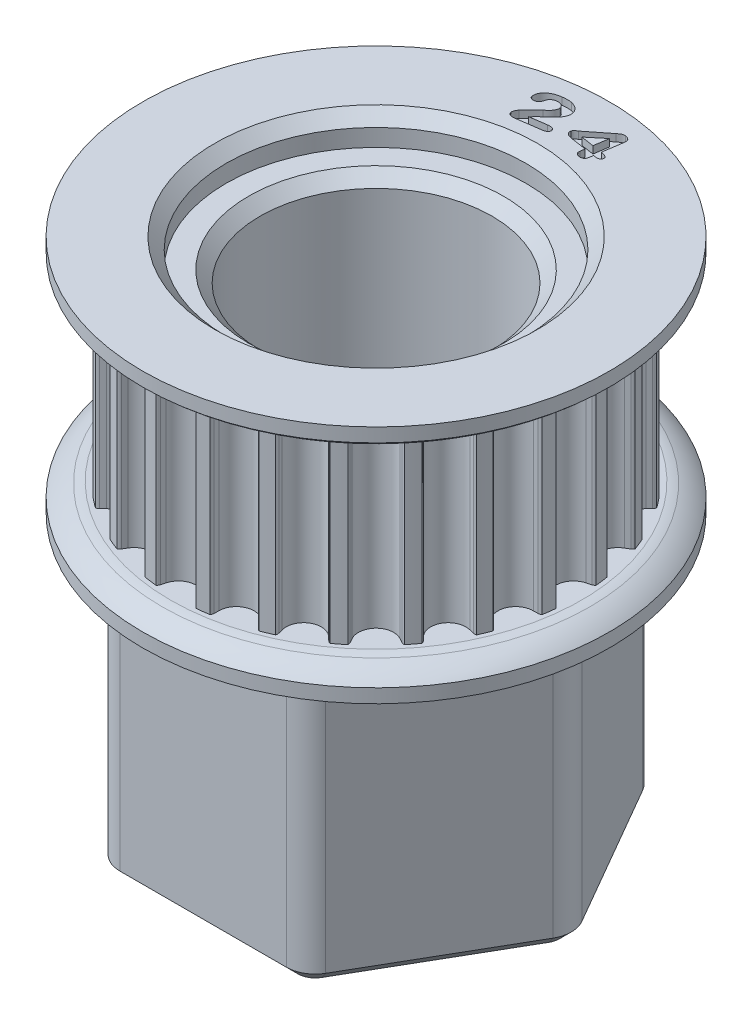
from build123d import *

# Parameters (mm, degrees)
SKETCH1_R                    = 11.078156269
TOOTHOD_DEPTH                = 5.08
TOOTHPROFILE_DEPTH           = 17.469896559
TOOTHPATTERN_COUNT           = 24
BORE_DEPTH                   = 20.343586122
BORE_DEPTH_BACK              = 20.343586122
SKETCH7_R                    = 6.3881
SMALL_TOOTH_COUNT_DEPTH      = 23.472489227
SMALL_TOOTH_COUNT_DEPTH_BACK = 0.4
SKETCH12_R                   = 6.3881
BOSS_EXTRUDE1_DEPTH          = 15.24
SKETCH27_R                   = 8.255
CUT_EXTRUDE1_DEPTH           = 1.5875
FILLET1_R                    = 1.5875
CUT_SWEEP1_PROFILE_R         = 0.3175
FILLET2_R                    = 1.27
CHAMFER1_SIZE                = 0.635
CHAMFER2_SIZE                = 0.635


with BuildPart() as part:
    # Sketch1 → ToothOD (new, symmetric)
    with BuildSketch(Plane(origin=(0, 0, 0), x_dir=(1, 0, 0), z_dir=(0, 1, 0))):
        Circle(SKETCH1_R)
    extrude(amount=TOOTHOD_DEPTH, both=True)

    # Sketch2 → ToothProfile (cut, symmetric)
    with BuildSketch(Plane(origin=(0, 0, 0), x_dir=(1, 0, 0), z_dir=(0, 1, 0))):
        with BuildLine():
            ThreePointArc((-0.937033068, 10.628218265), (-0.590385173, 10.110043655), (0, 9.909756269))
            ThreePointArc((0, 9.909756269), (0.590385173, 10.110043655), (0.937033068, 10.628218265))
            ThreePointArc((0.937033068, 10.628218265), (0.971699064, 10.754329727), (1.007805813, 10.880036269))
            ThreePointArc((1.007805813, 10.880036269), (1.043742495, 10.958436311), (1.100516181, 11.023357495))
            ThreePointArc((1.100516181, 11.023357495), (0, 11.078156269), (-1.100516181, 11.023357495))
            ThreePointArc((-1.100516181, 11.023357495), (-1.043742495, 10.958436311), (-1.007805813, 10.880036269))
            ThreePointArc((-1.007805813, 10.880036269), (-0.971699064, 10.754329727), (-0.937033068, 10.628218265))
        make_face()
    toothprofile = extrude(amount=TOOTHPROFILE_DEPTH, both=True, mode=Mode.SUBTRACT)

    # ToothPattern: ToothProfile ×24 about axis
    toothpattern_axis = Axis((0, 5.08, 0), (0, -1, 0))
    for i in range(1, TOOTHPATTERN_COUNT):
        add(toothprofile.rotate(toothpattern_axis, i * 360 / TOOTHPATTERN_COUNT), mode=Mode.SUBTRACT)

    # Sketch4 → Flange (revolve)
    with BuildSketch(Plane.XY):
        with BuildLine():
            Line((0, -5.08), (11.332156269, -5.08))
            ThreePointArc((11.332156269, -5.08), (11.56180289, -5.115951298), (11.787228598, -5.172637424))
            ThreePointArc((11.787228598, -5.172637424), (12.354957174, -5.454197125), (12.856156269, -5.842))
            Line((12.856156269, -5.842), (12.856156269, -6.604))
            Line((12.856156269, -6.604), (0, -6.604))
            Line((0, -6.604), (0, -5.08))
        make_face()
        with BuildLine():
            Line((12.856156269, 6.604), (12.856156269, 5.842))
            ThreePointArc((12.856156269, 5.842), (12.354957174, 5.454197125), (11.787228598, 5.172637424))
            ThreePointArc((11.787228598, 5.172637424), (11.56180289, 5.115951298), (11.332156269, 5.08))
            Line((11.332156269, 5.08), (0, 5.08))
            Line((0, 5.08), (0, 6.604))
            Line((0, 6.604), (12.856156269, 6.604))
        make_face()
    revolve(axis=Axis((0, 8.0264, 0), (0, -1, 0)))

    # Sketch7 → Bore (cut, two sides: drawn at the far end of the back side and taken through both)
    with BuildSketch(Plane.XZ.offset(-BORE_DEPTH_BACK)):
        Circle(SKETCH7_R)
    extrude(amount=BORE_DEPTH + BORE_DEPTH_BACK, mode=Mode.SUBTRACT)

    # Sketch11 → Small Tooth Count (cut, two sides: drawn at the far end of the back side and taken through both)
    # profile 1 of 2: a face of its own
    with BuildSketch(Plane(origin=(0, 6.604, 0), x_dir=(1, 0, 0), z_dir=(0, 1, 0)).offset(-SMALL_TOOTH_COUNT_DEPTH_BACK)):
        with BuildLine():
            Line((-1.50932721, 9.916837863), (-0.597606116, 10.046764816))
            add(Edge.make_bspline(
                [(-0.597606116, 10.046764816), (-0.571157489, 10.050105826), (-0.52120142, 10.056416311), (-0.449541333, 10.055313599), (-0.385667722, 10.047305308), (-0.330562884, 10.029277348), (-0.28444503, 10.005378402), (-0.249016623, 9.974662726), (-0.224075796, 9.938023746), (-0.217996356, 9.910169852), (-0.214969007, 9.896299582)],
                knots=[0, 0, 0, 0, 1.407436454, 2.658360686, 3.778686155, 4.796186387, 5.707822169, 6.504860125, 7.25547238, 8, 8, 8, 8], degree=3))
            add(Edge.make_bspline(
                [(-0.214969007, 9.896299582), (-0.213936308, 9.883603258), (-0.211851942, 9.857977408), (-0.222454605, 9.819456736), (-0.242047158, 9.78205115), (-0.270462476, 9.745517337), (-0.309742938, 9.712270871), (-0.360197484, 9.685833025), (-0.421026872, 9.665765439), (-0.465453114, 9.658287244), (-0.489110413, 9.654305051)],
                knots=[0, 0, 0, 0, 0.748192561, 1.510127746, 2.320859081, 3.236210595, 4.228876646, 5.33922549, 6.583118088, 8, 8, 8, 8], degree=3))
            Line((-0.489110413, 9.654305051), (-1.858031507, 9.458744894))
            add(Edge.make_bspline(
                [(-1.858031507, 9.458744894), (-1.881812164, 9.456078685), (-1.927114595, 9.450999526), (-1.992824891, 9.455151256), (-2.052190696, 9.468165459), (-2.104274077, 9.490978722), (-2.147742871, 9.521062832), (-2.181559921, 9.557126937), (-2.205078512, 9.598853341), (-2.211523929, 9.629488347), (-2.214772522, 9.644928879)],
                knots=[0, 0, 0, 0, 1.281292524, 2.440877223, 3.513557772, 4.524978182, 5.470507004, 6.329058183, 7.157818661, 8, 8, 8, 8], degree=3))
            add(Edge.make_bspline(
                [(-2.214772522, 9.644928879), (-2.215569805, 9.655797352), (-2.217301044, 9.679397428), (-2.212074679, 9.717481484), (-2.200960176, 9.760321538), (-2.184255907, 9.806310122), (-2.16419242, 9.852762198), (-2.140750929, 9.895489886), (-2.116593563, 9.93417597), (-2.097617179, 9.956478399), (-2.088417444, 9.967290597)],
                knots=[0, 0, 0, 0, 0.737310593, 1.601014737, 2.589839704, 3.735717173, 4.915099845, 6.016891089, 7.038590449, 8, 8, 8, 8], degree=3))
            add(Edge.make_bspline(
                [(-2.088417444, 9.967290597), (-2.052954712, 10.006233814), (-1.984101455, 10.081844663), (-1.882231331, 10.190148309), (-1.78600669, 10.290828012), (-1.70863357, 10.368561764), (-1.650073949, 10.425787839), (-1.610218762, 10.464524742), (-1.573038245, 10.499377239), (-1.539092018, 10.530615679), (-1.508517118, 10.558426697), (-1.480481045, 10.581976657), (-1.45629526, 10.602878662), (-1.440339068, 10.614629857), (-1.432978382, 10.620050754)],
                knots=[0, 0, 0, 0, 2.047788947, 3.975918602, 5.780698357, 7.462358793, 8.239809494, 8.964130096, 9.62319837, 10.221078995, 10.757845781, 11.229820742, 11.644711727, 12, 12, 12, 12], degree=3))
            add(Edge.make_bspline(
                [(-1.432978382, 10.620050754), (-1.411114208, 10.637295005), (-1.368791421, 10.670674943), (-1.309585205, 10.721861713), (-1.257517254, 10.773066677), (-1.210534252, 10.82242143), (-1.17028345, 10.87179307), (-1.135606303, 10.920131703), (-1.107860743, 10.968292082), (-1.08553367, 11.015174114), (-1.069936386, 11.061387106), (-1.059705317, 11.105925046), (-1.056275295, 11.149162831), (-1.058881911, 11.176977588), (-1.060163929, 11.190657785)],
                knots=[0, 0, 0, 0, 1.41082819, 2.730959837, 3.962766903, 5.109764772, 6.181493254, 7.187824709, 8.120338862, 8.994079246, 9.814383323, 10.586481619, 11.304785934, 12, 12, 12, 12], degree=3))
            add(Edge.make_bspline(
                [(-1.060163929, 11.190657785), (-1.062618629, 11.204494899), (-1.06747002, 11.231842127), (-1.083834468, 11.270115654), (-1.105489401, 11.305625195), (-1.133408735, 11.337522246), (-1.166046845, 11.366425296), (-1.203892765, 11.390361143), (-1.245966118, 11.410353932), (-1.292161897, 11.424992006), (-1.340996369, 11.435882109), (-1.391906039, 11.441117217), (-1.44430733, 11.441309423), (-1.479439833, 11.437047814), (-1.497272132, 11.434884738)],
                knots=[0, 0, 0, 0, 0.906920493, 1.792408525, 2.674642041, 3.589913914, 4.525093507, 5.487027952, 6.478087552, 7.532080477, 8.616620183, 9.711251621, 10.838293888, 12, 12, 12, 12], degree=3))
            add(Edge.make_bspline(
                [(-1.497272132, 11.434884738), (-1.514165051, 11.431956836), (-1.547305706, 11.426212856), (-1.594999107, 11.41181417), (-1.63941231, 11.392475804), (-1.680884552, 11.368710631), (-1.719132889, 11.340057857), (-1.753507144, 11.305976261), (-1.785597804, 11.268097526), (-1.803721896, 11.239846839), (-1.812936585, 11.225483566)],
                knots=[0, 0, 0, 0, 1.047578806, 2.055147905, 3.037331254, 4.003491932, 4.971707363, 5.949835577, 6.957651196, 8, 8, 8, 8], degree=3))
            add(Edge.make_bspline(
                [(-1.812936585, 11.225483566), (-1.814458795, 11.221775606), (-1.819020173, 11.210664523), (-1.826430513, 11.187392943), (-1.8363605, 11.151981445), (-1.848825896, 11.106904921), (-1.864197864, 11.057785769), (-1.883498509, 11.010024351), (-1.907843305, 10.967140907), (-1.933918105, 10.926754831), (-1.968424595, 10.891810149), (-2.013254557, 10.864955698), (-2.067652355, 10.844897277), (-2.107752263, 10.83772542), (-2.129047522, 10.833916769)],
                knots=[0, 0, 0, 0, 0.265007539, 0.794108009, 1.613373207, 2.697617163, 3.886602221, 5.01617726, 6.095451393, 7.143719409, 8.187635248, 9.310199435, 10.571567743, 12, 12, 12, 12], degree=3))
            add(Edge.make_bspline(
                [(-2.129047522, 10.833916769), (-2.145702833, 10.832148904), (-2.177842142, 10.828737501), (-2.225347998, 10.833205546), (-2.269895483, 10.844047702), (-2.310724724, 10.862888812), (-2.346516666, 10.888526805), (-2.374439978, 10.921981153), (-2.393798514, 10.962258671), (-2.399679354, 10.991777532), (-2.402742444, 11.007152707)],
                knots=[0, 0, 0, 0, 1.103853878, 2.130077396, 3.133877759, 4.119166359, 5.082634088, 6.017851916, 6.96757965, 8, 8, 8, 8], degree=3))
            add(Edge.make_bspline(
                [(-2.402742444, 11.007152707), (-2.404621818, 11.025443769), (-2.408440344, 11.062607704), (-2.404036406, 11.119951061), (-2.393382933, 11.179126415), (-2.374872021, 11.239758118), (-2.349177564, 11.300687215), (-2.315494278, 11.36032443), (-2.273763975, 11.417744069), (-2.225138897, 11.473717212), (-2.168189831, 11.527075519), (-2.102387044, 11.576589749), (-2.02866634, 11.622983283), (-1.946451016, 11.665537987), (-1.855893746, 11.703375453), (-1.756635021, 11.735560403), (-1.648939306, 11.761335845), (-1.573863538, 11.773374554), (-1.535223304, 11.779570676)],
                knots=[0, 0, 0, 0, 0.686667313, 1.395176401, 2.14217196, 2.933050997, 3.761378171, 4.611517609, 5.489179995, 6.412591937, 7.381608954, 8.40276096, 9.488705709, 10.636721208, 11.862062126, 13.156195851, 14.536341884, 16, 16, 16, 16], degree=3))
            add(Edge.make_bspline(
                [(-1.535223304, 11.779570676), (-1.51098446, 11.782864739), (-1.463484936, 11.789319934), (-1.3931866, 11.795965108), (-1.325279482, 11.800104771), (-1.259746788, 11.801309567), (-1.196738069, 11.800639843), (-1.136249357, 11.797045796), (-1.078284928, 11.79091863), (-1.0406437, 11.784799376), (-1.022212757, 11.781803097)],
                knots=[0, 0, 0, 0, 1.139510729, 2.233036297, 3.288782861, 4.308228055, 5.285958018, 6.223630361, 7.130204615, 8, 8, 8, 8], degree=3))
            add(Edge.make_bspline(
                [(-1.022212757, 11.781803097), (-0.996346238, 11.776001966), (-0.945668387, 11.764636353), (-0.873068597, 11.740276391), (-0.805417719, 11.710781694), (-0.742751011, 11.676450968), (-0.685656039, 11.637533154), (-0.633786844, 11.595223091), (-0.58870652, 11.54841819), (-0.54906255, 11.498825501), (-0.516177347, 11.446357641), (-0.489829112, 11.391805019), (-0.470755505, 11.33520861), (-0.463644085, 11.296287026), (-0.460088929, 11.276829269)],
                knots=[0, 0, 0, 0, 1.184878925, 2.321422417, 3.418236948, 4.481667666, 5.511750754, 6.504540555, 7.469430236, 8.412213537, 9.339242204, 10.232319117, 11.116297388, 12, 12, 12, 12], degree=3))
            add(Edge.make_bspline(
                [(-0.460088929, 11.276829269), (-0.458344915, 11.26151817), (-0.454881571, 11.231112681), (-0.454228176, 11.185416025), (-0.456587369, 11.139957574), (-0.463987312, 11.095046809), (-0.474807198, 11.050442291), (-0.489144725, 11.006067202), (-0.507281058, 10.961900847), (-0.537254061, 10.905276357), (-0.576759476, 10.838655761), (-0.626292967, 10.765363592), (-0.676992982, 10.701276091), (-0.722071621, 10.653855546), (-0.761194236, 10.617845627), (-0.794206933, 10.586849676), (-0.832065984, 10.552066211), (-0.87505434, 10.51382363), (-0.922365044, 10.471389469), (-0.974062376, 10.42482995), (-1.030912184, 10.37483785), (-1.091062336, 10.322368683), (-1.150688874, 10.269172522), (-1.207256163, 10.218149043), (-1.258914453, 10.170234867), (-1.305402401, 10.125022937), (-1.347010294, 10.083115848), (-1.383776929, 10.044108725), (-1.415868177, 10.008409704), (-1.434851705, 9.9849262), (-1.443694007, 9.973987863)],
                knots=[0, 0, 0, 0, 0.764715832, 1.518608056, 2.266281531, 3.021946302, 3.774714963, 4.543561344, 5.335395795, 6.141819471, 7.722191955, 9.179477286, 10.530900026, 11.774914819, 12.423188144, 13.170861619, 14.023369367, 14.975807079, 16.027662526, 17.178935749, 18.430237895, 19.786500845, 21.142119432, 22.397756293, 23.568968093, 24.640267795, 25.617411505, 26.500872375, 27.301724132, 28, 28, 28, 28], degree=3))
            add(Edge.make_bspline(
                [(-1.443694007, 9.973987863), (-1.453364212, 9.963671779), (-1.47330175, 9.942402602), (-1.497081325, 9.925527908), (-1.50932721, 9.916837863)],
                knots=[0, 0, 0, 0, 0.970050127, 2, 2, 2, 2], degree=3))
        make_face()
    # profile 2 of 2: a face of its own
    with BuildSketch(Plane(origin=(0, 6.604, 0), x_dir=(1, 0, 0), z_dir=(0, 1, 0)).offset(-SMALL_TOOTH_COUNT_DEPTH_BACK)):
        with BuildLine():
            Line((1.54875845, 9.694357822), (1.584923685, 9.933226963))
            Line((1.584923685, 9.933226963), (0.682132279, 10.069851181))
            add(Edge.make_bspline(
                [(0.682132279, 10.069851181), (0.667069888, 10.072365675), (0.637833552, 10.077246347), (0.59577177, 10.087058213), (0.55695217, 10.098786908), (0.52087805, 10.111393675), (0.488418367, 10.126838621), (0.458477124, 10.143111023), (0.432269492, 10.162056812), (0.408693626, 10.18212698), (0.38870757, 10.203944717), (0.371885868, 10.226994313), (0.35840571, 10.251290566), (0.348018344, 10.276733106), (0.341320451, 10.303508094), (0.337827643, 10.331370309), (0.337171075, 10.360614092), (0.339714529, 10.380324227), (0.341018216, 10.390426963)],
                knots=[0, 0, 0, 0, 1.388781889, 2.695647554, 3.924835582, 5.076755441, 6.166884665, 7.191145902, 8.171528826, 9.102438726, 10.003031995, 10.85597153, 11.692204285, 12.524262991, 13.348354993, 14.194608087, 15.074618352, 16, 16, 16, 16], degree=3))
            add(Edge.make_bspline(
                [(0.341018216, 10.390426963), (0.343314029, 10.401766071), (0.347905655, 10.424444287), (0.364951704, 10.456369439), (0.388568217, 10.486709873), (0.418275625, 10.515685703), (0.450792773, 10.54325826), (0.483165479, 10.570045891), (0.516726241, 10.593594233), (0.541010266, 10.605208787), (0.553098294, 10.610990244)],
                knots=[0, 0, 0, 0, 0.874989528, 1.749979056, 2.718094681, 3.789673942, 4.896134263, 5.957640263, 6.983360329, 8, 8, 8, 8], degree=3))
            Line((0.553098294, 10.610990244), (1.705027982, 11.518692978))
            add(Edge.make_bspline(
                [(1.705027982, 11.518692978), (1.723363136, 11.532991398), (1.757949305, 11.559962949), (1.808225363, 11.595384396), (1.852746903, 11.624819107), (1.892637113, 11.648787092), (1.932025804, 11.666045934), (1.973483961, 11.675129197), (2.017493428, 11.678705146), (2.047351945, 11.6750505), (2.062661966, 11.673176572)],
                knots=[0, 0, 0, 0, 1.385215562, 2.61297499, 3.66319543, 4.565137817, 5.383713486, 6.211887483, 7.083141318, 8, 8, 8, 8], degree=3))
            add(Edge.make_bspline(
                [(2.062661966, 11.673176572), (2.076257006, 11.671040484), (2.102449413, 11.666925065), (2.139810345, 11.656941366), (2.174575329, 11.646872817), (2.206120926, 11.633628939), (2.234672364, 11.618826973), (2.260956403, 11.602999155), (2.283731023, 11.58450638), (2.303810023, 11.564346874), (2.320102009, 11.541778551), (2.334314126, 11.518050763), (2.345011256, 11.492131061), (2.353022598, 11.464600848), (2.358015704, 11.435084984), (2.359498037, 11.403817064), (2.358831026, 11.370632185), (2.355784412, 11.348116563), (2.354216263, 11.336527353)],
                knots=[0, 0, 0, 0, 1.293804893, 2.49266397, 3.63541932, 4.696405976, 5.704707744, 6.66060036, 7.576904144, 8.458193591, 9.329188293, 10.188967274, 11.054995144, 11.959019234, 12.88214529, 13.86394316, 14.900531759, 16, 16, 16, 16], degree=3))
            Line((2.354216263, 11.336527353), (2.1845522, 10.222102353))
            Line((2.1845522, 10.222102353), (2.207322904, 10.218530478))
            add(Edge.make_bspline(
                [(2.207322904, 10.218530478), (2.232248392, 10.214268879), (2.280202022, 10.206070076), (2.348269361, 10.188595146), (2.409795368, 10.167787516), (2.456229433, 10.147023934), (2.48888784, 10.127893843), (2.509196551, 10.111682906), (2.526056243, 10.093814855), (2.538824571, 10.073635644), (2.547904264, 10.051594759), (2.552635086, 10.027515392), (2.554062763, 10.001786493), (2.552120748, 9.984263558), (2.551115872, 9.975196494)],
                knots=[0, 0, 0, 0, 1.927642278, 3.708550971, 5.352300247, 6.875759797, 7.578383738, 8.232399134, 8.850783688, 9.442669577, 10.04330382, 10.657613479, 11.305395775, 12, 12, 12, 12], degree=3))
            add(Edge.make_bspline(
                [(2.551115872, 9.975196494), (2.547955126, 9.96102685), (2.541797823, 9.933423624), (2.517793864, 9.897447274), (2.483869765, 9.869057778), (2.439811976, 9.848735526), (2.387159558, 9.83647943), (2.326366538, 9.831010515), (2.257659441, 9.832569738), (2.209510712, 9.838837208), (2.184105716, 9.84214415)],
                knots=[0, 0, 0, 0, 0.796932365, 1.552466999, 2.340640896, 3.216672216, 4.208643632, 5.316555866, 6.584118596, 8, 8, 8, 8], degree=3))
            Line((2.184105716, 9.84214415), (2.127848685, 9.850627353))
            Line((2.127848685, 9.850627353), (2.09168345, 9.611758213))
            add(Edge.make_bspline(
                [(2.09168345, 9.611758213), (2.087915831, 9.593695487), (2.080686946, 9.559038758), (2.05877288, 9.511463546), (2.027421046, 9.471942372), (1.987626923, 9.440800936), (1.941248649, 9.417609853), (1.888057705, 9.405099886), (1.829490591, 9.400928089), (1.789087064, 9.405679459), (1.767982279, 9.408161338)],
                knots=[0, 0, 0, 0, 1.023598687, 1.96396612, 2.882860389, 3.801754658, 4.752874875, 5.742353606, 6.820718238, 8, 8, 8, 8], degree=3))
            add(Edge.make_bspline(
                [(1.767982279, 9.408161338), (1.749936329, 9.411515451), (1.715051993, 9.417999234), (1.667376192, 9.438251786), (1.625447447, 9.464339438), (1.590867277, 9.497992309), (1.564133216, 9.53845956), (1.54803808, 9.585677285), (1.542213237, 9.638713459), (1.54650315, 9.675184309), (1.54875845, 9.694357822)],
                knots=[0, 0, 0, 0, 1.075850784, 2.079709954, 3.02358972, 3.963774271, 4.892949688, 5.847308372, 6.868283553, 8, 8, 8, 8], degree=3))
        make_face()
        Polygon((0.929484622, 10.412751181), (1.6416272, 10.304701963), (1.763517435, 11.104801963), align=None, mode=Mode.SUBTRACT)
    extrude(amount=SMALL_TOOTH_COUNT_DEPTH + SMALL_TOOTH_COUNT_DEPTH_BACK, mode=Mode.SUBTRACT)

    # Sketch12 → Boss-Extrude1 (add)
    with BuildSketch(Plane.XZ.offset(6.604)):
        Polygon((5.499261314, -9.525), (10.998522628, 0), (5.499261314, 9.525), (-5.499261314, 9.525), (-10.998522628, 0), (-5.499261314, -9.525), align=None)
        Circle(SKETCH12_R, mode=Mode.SUBTRACT)
    extrude(amount=BOSS_EXTRUDE1_DEPTH)

    # Sketch27 → Cut-Extrude1 (cut)
    with BuildSketch(Plane(origin=(0, 6.604, 0), x_dir=(1, 0, 0), z_dir=(0, 1, 0))):
        Circle(SKETCH27_R)
    extrude(amount=-CUT_EXTRUDE1_DEPTH, mode=Mode.SUBTRACT)

    # Fillet1
    fillet1_edges = [part.edges().sort_by_distance(p)[0] for p in [
        (-5.499261314, -14.224, 9.525),
        (5.499261314, -14.224, 9.525),
        (10.998522628, -14.224, 0),
        (5.499261314, -14.224, -9.525),
        (-10.998522628, -14.224, 0),
        (-5.499261314, -14.224, -9.525),
    ]]
    fillet(fillet1_edges, radius=FILLET1_R)

    # Cut-Sweep1: sweep along a path in Sketch25
    with BuildLine(Plane.XZ.offset(6.604)) as cut_sweep1_path:
        Line((-4.582717762, -9.525), (4.582717762, -9.525))
        ThreePointArc((4.582717762, -9.525), (5.376467762, -9.312315329), (5.95753309, -8.73125))
        Line((5.95753309, -8.73125), (10.540250852, -0.79375))
        ThreePointArc((10.540250852, -0.79375), (10.752935523, 0), (10.540250852, 0.79375))
        Line((10.540250852, 0.79375), (5.95753309, 8.73125))
        ThreePointArc((5.95753309, 8.73125), (5.376467762, 9.312315329), (4.582717762, 9.525))
        Line((4.582717762, 9.525), (-4.582717762, 9.525))
        ThreePointArc((-4.582717762, 9.525), (-5.376467762, 9.312315329), (-5.95753309, 8.73125))
        Line((-5.95753309, 8.73125), (-10.540250852, 0.79375))
        ThreePointArc((-10.540250852, 0.79375), (-10.752935523, 0), (-10.540250852, -0.79375))
        Line((-10.540250852, -0.79375), (-5.95753309, -8.73125))
        ThreePointArc((-5.95753309, -8.73125), (-5.376467762, -9.312315329), (-4.582717762, -9.525))
    # Cut-Sweep1 profile (on start of the path) → Cut-Sweep1 (sweep, cut)
    with BuildSketch(Plane(origin=(-4.582717762, -6.604, -9.525), x_dir=(0, 0, 1), z_dir=(1, 0, 0))):
        Circle(CUT_SWEEP1_PROFILE_R)
    sweep(path=cut_sweep1_path.line, mode=Mode.SUBTRACT)

    # Fillet2
    fillet2_edges = [part.edges().sort_by_distance(p)[0] for p in [
        (-5.535217762, -6.604, 9.587278394),
        (0, -6.604, 9.8425),
        (5.535217762, -6.604, 9.587278394),
        (8.523855037, -6.604, 4.92125),
        (11.070435523, -6.604, 0),
        (8.523855037, -6.604, -4.92125),
        (5.535217762, -6.604, -9.587278394),
        (0, -6.604, -9.8425),
        (-5.535217762, -6.604, -9.587278394),
        (-8.523855037, -6.604, -4.92125),
        (-11.070435523, -6.604, 0),
        (-10.752935523, -6.9215, 0),
        (-8.248891971, -6.9215, -4.7625),
        (-5.376467762, -6.9215, -9.312315329),
        (0, -6.9215, -9.525),
        (5.376467762, -6.9215, -9.312315329),
        (8.248891971, -6.9215, -4.7625),
        (10.752935523, -6.9215, 0),
        (8.248891971, -6.9215, 4.7625),
        (5.376467762, -6.9215, 9.312315329),
        (0, -6.9215, 9.525),
        (-5.376467762, -6.9215, 9.312315329),
        (-8.523855037, -6.604, 4.92125),
        (-8.248891971, -6.9215, 4.7625),
    ]]
    fillet(fillet2_edges, radius=FILLET2_R)

    # Chamfer1
    chamfer1_edges = [part.edges().sort_by_distance(p)[0] for p in [
        (-6.3881, -21.844, 0),
        (-8.255, 6.604, 0),
        (-6.3881, 5.0165, 0),
    ]]
    chamfer(chamfer1_edges, length=CHAMFER1_SIZE)

    # Chamfer2
    chamfer2_edges = [part.edges().sort_by_distance(p)[0] for p in [
        (0, -21.844, -9.525),
        (5.376467762, -21.844, -9.312315329),
        (-5.376467762, -21.844, -9.312315329),
        (8.248891971, -21.844, -4.7625),
        (-8.248891971, -21.844, -4.7625),
        (10.752935523, -21.844, 0),
        (-10.752935523, -21.844, 0),
        (8.248891971, -21.844, 4.7625),
        (-8.248891971, -21.844, 4.7625),
        (5.376467762, -21.844, 9.312315329),
        (-5.376467762, -21.844, 9.312315329),
        (0, -21.844, 9.525),
    ]]
    chamfer(chamfer2_edges, length=CHAMFER2_SIZE)


solid = part.part
